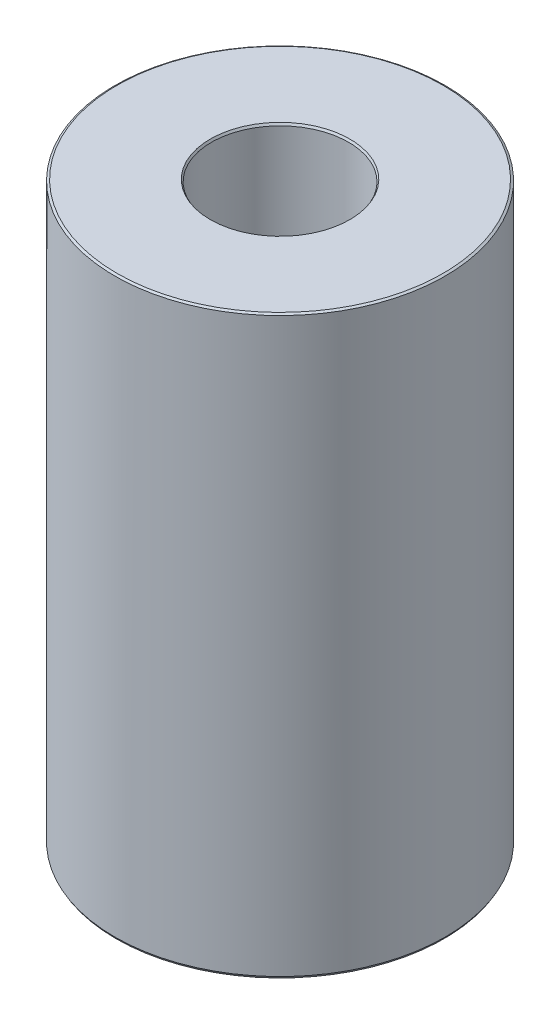
from build123d import *
from OCP.BRepFilletAPI import BRepFilletAPI_MakeChamfer

# Parameters (mm, degrees)
SKETCH1_R           = 35
BOSS_EXTRUDE1_DEPTH = 122.043287806
SKETCH2_R           = 14.537154817
CUT_EXTRUDE1_DEPTH  = 132.698762706
CHAMFER1_SIZE       = 0.262486742
CHAMFER1_SIZE2      = 0.454640373


with BuildPart() as part:
    # Sketch1 → Boss-Extrude1 (new body)
    with BuildSketch(Plane(origin=(0, 0, 0), x_dir=(1, 0, 0), z_dir=(0, 1, 0))):
        Circle(SKETCH1_R)
    extrude(amount=BOSS_EXTRUDE1_DEPTH)

    # Sketch2 → Cut-Extrude1 (cut, through all)
    with BuildSketch(Plane(origin=(0, 0, 0), x_dir=(1, 0, 0), z_dir=(0, 1, 0))):
        Circle(SKETCH2_R)
    extrude(amount=CUT_EXTRUDE1_DEPTH, mode=Mode.SUBTRACT)

    # Chamfer1: one chamfer whose edges measure the first distance from different faces: ONE call of the kernel's chamfer builder (chamfer() names one face for all edges)
    chamfer1_edges_1 = [part.edges().sort_by_distance(p)[0] for p in [
        (-14.537154817, 122.043287806, 0),
    ]]
    chamfer1_side_1 = [part.faces().sort_by_distance(p)[0] for p in [
        (-34.010050506, 122.043287806, 0),
    ]]
    chamfer1_edges_2 = [part.edges().sort_by_distance(p)[0] for p in [
        (-14.537154817, 0, 0),
    ]]
    chamfer1_side_2 = [part.faces().sort_by_distance(p)[0] for p in [
        (-14.537154817, 61.021643903, 0),
    ]]
    chamfer1_edges_3 = [part.edges().sort_by_distance(p)[0] for p in [
        (-35, 0, 0),
    ]]
    chamfer1_side_3 = [part.faces().sort_by_distance(p)[0] for p in [
        (-34.010050506, 0, 0),
    ]]
    chamfer1_edges_4 = [part.edges().sort_by_distance(p)[0] for p in [
        (-35, 122.043287806, 0),
    ]]
    chamfer1_side_4 = [part.faces().sort_by_distance(p)[0] for p in [
        (-35, 61.021643903, 0),
    ]]
    chamfer1 = BRepFilletAPI_MakeChamfer(part.part.solid().wrapped)
    for e in chamfer1_edges_1:
        chamfer1.Add(CHAMFER1_SIZE, CHAMFER1_SIZE2, e.wrapped, chamfer1_side_1[0].wrapped)  # the first distance lies on this face
    for e in chamfer1_edges_2:
        chamfer1.Add(CHAMFER1_SIZE, CHAMFER1_SIZE2, e.wrapped, chamfer1_side_2[0].wrapped)  # the first distance lies on this face
    for e in chamfer1_edges_3:
        chamfer1.Add(CHAMFER1_SIZE, CHAMFER1_SIZE2, e.wrapped, chamfer1_side_3[0].wrapped)  # the first distance lies on this face
    for e in chamfer1_edges_4:
        chamfer1.Add(CHAMFER1_SIZE, CHAMFER1_SIZE2, e.wrapped, chamfer1_side_4[0].wrapped)  # the first distance lies on this face
    add(Compound.cast(chamfer1.Shape()), mode=Mode.REPLACE)


solid = part.part
